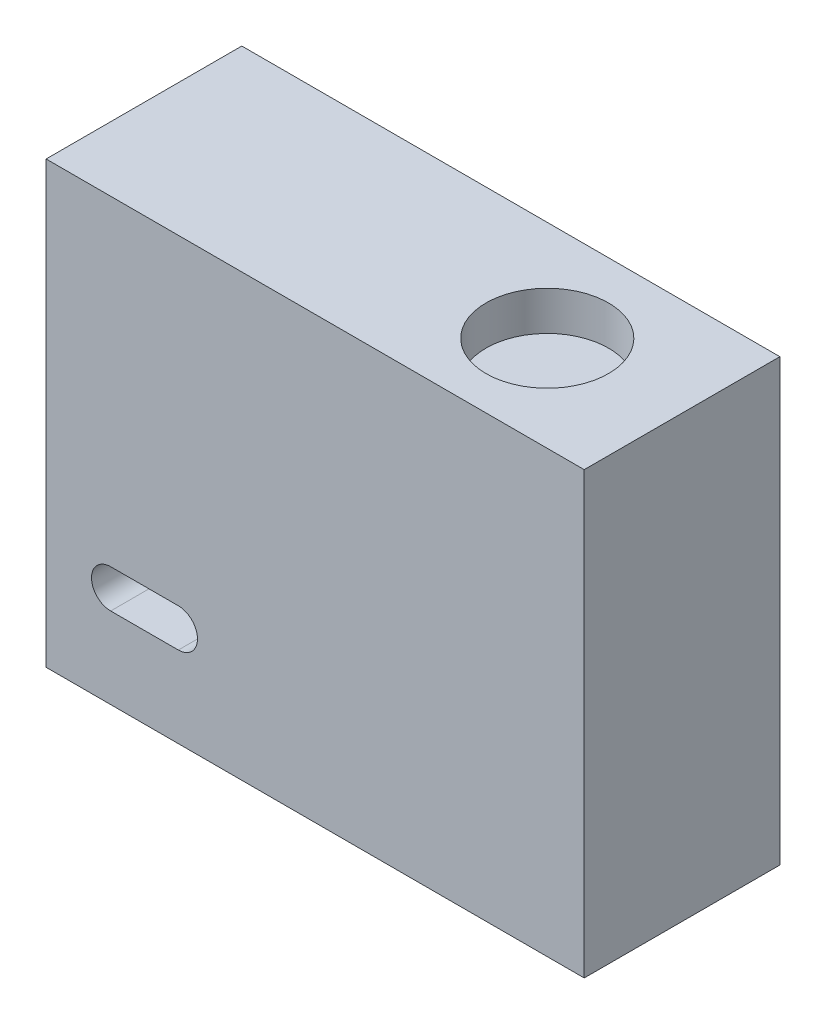
from build123d import *

# Parameters (mm, degrees)
SKETCH_1_W          = 110
SKETCH_1_H          = 90
EXTRUDE_1_DEPTH     = 40
SKETCH_2_W          = 95
SKETCH_2_H          = 60
CUT_EXTRUDE_1_DEPTH = 30
SKETCH_3_R          = 12.520681094
CUT_EXTRUDE_2_DEPTH = 8
CUT_EXTRUDE_3_DEPTH = 18


with BuildPart() as part:
    # 草图1 → 凸台-拉伸1 (new body)
    with BuildSketch(Plane.XY):
        Rectangle(SKETCH_1_W, SKETCH_1_H)
    extrude(amount=EXTRUDE_1_DEPTH)

    # 草图2 → 切除-拉伸1 (cut)
    with BuildSketch(Plane.XY):
        Rectangle(SKETCH_2_W, SKETCH_2_H)
    extrude(amount=CUT_EXTRUDE_1_DEPTH, mode=Mode.SUBTRACT)

    # 草图3 → 切除-拉伸2 (cut)
    with BuildSketch(Plane(origin=(0, 45, 0), x_dir=(1, 0, 0), z_dir=(0, 1, 0))):
        with Locations((27.963854688, -20.514543773)):
            Circle(SKETCH_3_R)
    extrude(amount=-CUT_EXTRUDE_2_DEPTH, mode=Mode.SUBTRACT)

    # 草图4 → 切除-拉伸3 (cut)
    with BuildSketch(Plane.XY.offset(40)):
        with BuildLine():
            Line((-41.801373068, -20.587236768), (-27.973153706, -20.587236768))
            ThreePointArc((-27.973153706, -20.587236768), (-24.055538446, -24.504852028), (-27.973153706, -28.422467288))
            Line((-27.973153706, -28.422467288), (-41.801373068, -28.422467288))
            ThreePointArc((-41.801373068, -28.422467288), (-45.718988328, -24.504852028), (-41.801373068, -20.587236768))
        make_face()
    extrude(amount=-CUT_EXTRUDE_3_DEPTH, mode=Mode.SUBTRACT)


solid = part.part
